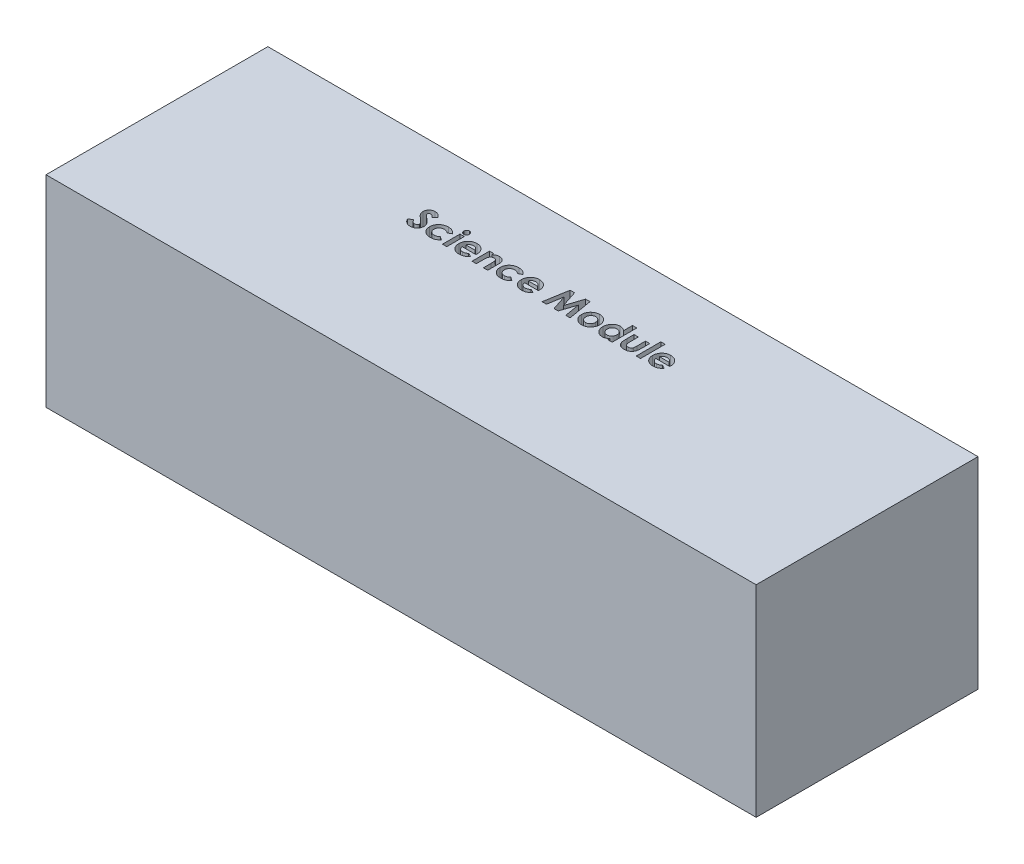
from build123d import *

# Parameters (mm, degrees)
SKETCH1_W           = 564
SKETCH1_H           = 176.20137931
BOSS_EXTRUDE1_DEPTH = 160
SKETCH2_W           = 3.419230769
SKETCH2_H           = 13.921153846
SKETCH2_H_2         = 19.538461538
CUT_EXTRUDE1_DEPTH  = 160


with BuildPart() as part:
    # Sketch1 → Boss-Extrude1 (new body)
    with BuildSketch(Plane(origin=(0, 0, 0), x_dir=(1, 0, 0), z_dir=(0, 1, 0))):
        with Locations((282, 88.100689655)):
            Rectangle(SKETCH1_W, SKETCH1_H)
    extrude(amount=BOSS_EXTRUDE1_DEPTH)

    # Sketch2 → Cut-Extrude1 (cut)
    # profile 1 of 14: a face of its own
    with BuildSketch(Plane(origin=(0, 160, 0), x_dir=(1, 0, 0), z_dir=(0, 1, 0))):
        with BuildLine():
            Line((185.175034233, 126.18146838), (182.618243367, 123.842195543))
            add(Edge.make_bspline(
                [(182.618243367, 123.842195543), (182.50872141, 123.99668765), (182.298454525, 124.293290951), (181.957633836, 124.690449761), (181.618352127, 125.029255783), (181.27746616, 125.30829364), (180.931954451, 125.525867971), (180.582416757, 125.679913001), (180.230834706, 125.777840888), (179.99462584, 125.790035267), (179.878279425, 125.796041697)],
                knots=[0, 0, 0, 0, 1.299362458, 2.494594718, 3.587462134, 4.587049575, 5.512617175, 6.380583204, 7.202344345, 8, 8, 8, 8], degree=3))
            add(Edge.make_bspline(
                [(179.878279425, 125.796041697), (179.769754827, 125.792235747), (179.56022234, 125.784887458), (179.261518235, 125.711846008), (178.996324477, 125.585787192), (178.764899883, 125.420954686), (178.581577461, 125.22236973), (178.435208723, 125.014105171), (178.352790824, 124.784228199), (178.341943007, 124.626339422), (178.336572694, 124.548175111)],
                knots=[0, 0, 0, 0, 1.185010067, 2.2879431, 3.333075148, 4.379039566, 5.372662701, 6.27520591, 7.14612461, 8, 8, 8, 8], degree=3))
            add(Edge.make_bspline(
                [(178.336572694, 124.548175111), (178.339937997, 124.468883636), (178.346715249, 124.309201624), (178.412174282, 124.075167749), (178.510839734, 123.846489409), (178.605118602, 123.707282023), (178.653309473, 123.636125832)],
                knots=[0, 0, 0, 0, 0.967525499, 1.948461899, 2.951351359, 4, 4, 4, 4], degree=3))
            add(Edge.make_bspline(
                [(178.653309473, 123.636125832), (178.697120187, 123.580816869), (178.797966666, 123.453502941), (178.990260246, 123.251857526), (179.231740597, 123.004824242), (179.531700393, 122.720897839), (179.877687476, 122.389867215), (180.285738795, 122.024745308), (180.744108854, 121.614224718), (181.069907672, 121.328353046), (181.240629185, 121.178553716)],
                knots=[0, 0, 0, 0, 0.473873513, 1.090794244, 1.870441696, 2.795289791, 3.865433203, 5.087734844, 6.473946851, 8, 8, 8, 8], degree=3))
            add(Edge.make_bspline(
                [(181.240629185, 121.178553716), (181.400875882, 121.039868283), (181.704990822, 120.776672142), (182.137685989, 120.403107479), (182.517952976, 120.067020461), (182.851331406, 119.773455034), (183.132767586, 119.519331025), (183.363444676, 119.303433724), (183.546180004, 119.129966255), (183.650054338, 119.025191798), (183.694385194, 118.980476793)],
                knots=[0, 0, 0, 0, 1.543621617, 2.929473131, 4.163658386, 5.240097082, 6.164993805, 6.925417477, 7.541396219, 8, 8, 8, 8], degree=3))
            add(Edge.make_bspline(
                [(183.694385194, 118.980476793), (183.862567218, 118.798467824), (184.185872131, 118.448582666), (184.606054546, 117.906370708), (184.951878265, 117.377061278), (185.219414052, 116.85069456), (185.421467838, 116.31967613), (185.563918434, 115.77098279), (185.649233044, 115.198881038), (185.658704958, 114.808491433), (185.663495771, 114.611035688)],
                knots=[0, 0, 0, 0, 1.206664779, 2.319633467, 3.337109185, 4.282041471, 5.190008762, 6.099243693, 7.03861361, 8, 8, 8, 8], degree=3))
            add(Edge.make_bspline(
                [(185.663495771, 114.611035688), (185.660085793, 114.418639279), (185.653395288, 114.041150366), (185.57144944, 113.488751571), (185.45459947, 112.960081949), (185.273928918, 112.460894174), (185.053728718, 111.98299423), (184.777675965, 111.53382628), (184.453489859, 111.108844559), (184.081922804, 110.715646136), (183.670925521, 110.358845821), (183.230091874, 110.041213752), (182.75511117, 109.778968021), (182.25004157, 109.563027367), (181.715153425, 109.396706988), (181.151083949, 109.273780727), (180.556970359, 109.200002323), (180.150706925, 109.192289666), (179.943153223, 109.188349389)],
                knots=[0, 0, 0, 0, 1.043214005, 2.046824704, 3.02475056, 3.976699089, 4.921714032, 5.875962561, 6.831408892, 7.817874052, 8.806269674, 9.781291748, 10.760897367, 11.74438705, 12.757449933, 13.795994037, 14.874007457, 16, 16, 16, 16], degree=3))
            add(Edge.make_bspline(
                [(179.943153223, 109.188349389), (179.780225334, 109.191239839), (179.457534675, 109.196964586), (178.981937429, 109.243702382), (178.522694525, 109.319132213), (178.080323258, 109.427245693), (177.652830669, 109.564240136), (177.2401992, 109.731573599), (176.845277383, 109.93183969), (176.465077054, 110.16092014), (176.101446454, 110.426912719), (175.749787619, 110.724379294), (175.413593556, 111.057895034), (175.091249595, 111.426671189), (174.784818181, 111.831752043), (174.484268716, 112.267496096), (174.202958522, 112.741990165), (174.029180701, 113.074851594), (173.940418848, 113.244869822)],
                knots=[0, 0, 0, 0, 1.016823716, 2.013894106, 2.979844003, 3.91962641, 4.853723003, 5.779685073, 6.695824784, 7.614987388, 8.547259901, 9.504950863, 10.487499108, 11.500346958, 12.559593716, 13.656357062, 14.802919212, 16, 16, 16, 16], degree=3))
            Line((173.940418848, 113.244869822), (176.947510194, 115.049887851))
            add(Edge.make_bspline(
                [(176.947510194, 115.049887851), (177.058538006, 114.856894947), (177.271387811, 114.486911057), (177.632081705, 113.989790807), (178.001594184, 113.564089602), (178.388468048, 113.217331737), (178.787999054, 112.944880614), (179.20211703, 112.750168141), (179.631112927, 112.62964134), (179.923325444, 112.614922234), (180.069084713, 112.607580159)],
                knots=[0, 0, 0, 0, 1.283663364, 2.460892379, 3.537111102, 4.529833553, 5.449777664, 6.316464042, 7.160231139, 8, 8, 8, 8], degree=3))
            add(Edge.make_bspline(
                [(180.069084713, 112.607580159), (180.217342759, 112.613576095), (180.504984959, 112.625209085), (180.915557392, 112.732659506), (181.291985744, 112.901364549), (181.617367632, 113.142083382), (181.892880499, 113.419909502), (182.09622481, 113.729003763), (182.223967077, 114.063436293), (182.237472532, 114.295755126), (182.244265002, 114.412598188)],
                knots=[0, 0, 0, 0, 1.13588714, 2.203786484, 3.234766741, 4.283437687, 5.291419208, 6.222934724, 7.106237994, 8, 8, 8, 8], degree=3))
            add(Edge.make_bspline(
                [(182.244265002, 114.412598188), (182.237992434, 114.521301642), (182.225250313, 114.742122303), (182.131395775, 115.070447118), (181.984672506, 115.398622618), (181.811088532, 115.667801041), (181.634445102, 115.893176839), (181.465534142, 116.088454772), (181.259845275, 116.304202701), (181.017900036, 116.540692021), (180.742895155, 116.800004607), (180.434598975, 117.082115066), (180.089481179, 117.384538343), (179.84555124, 117.590546091), (179.718002983, 117.698265255)],
                knots=[0, 0, 0, 0, 0.916159276, 1.861089862, 2.860218735, 3.940849679, 4.552606315, 5.27541173, 6.11797699, 7.06649574, 8.129236253, 9.306560635, 10.591630461, 12, 12, 12, 12], degree=3))
            add(Edge.make_bspline(
                [(179.718002983, 117.698265255), (179.475528669, 117.903421775), (179.010147071, 118.297179234), (178.352503829, 118.878746605), (177.759908383, 119.422274601), (177.237479024, 119.934482418), (176.778559194, 120.405910763), (176.386256897, 120.840388758), (176.064881753, 121.241267807), (175.726703711, 121.716082213), (175.405366957, 122.294676193), (175.127640814, 122.990791825), (174.947463814, 123.68681913), (174.927277487, 124.154093526), (174.917341925, 124.384082563)],
                knots=[0, 0, 0, 0, 1.345494975, 2.582412109, 3.71882943, 4.751509156, 5.681369928, 6.505683931, 7.230279997, 7.856715994, 8.973648664, 10.023341002, 11.027102913, 12, 12, 12, 12], degree=3))
            add(Edge.make_bspline(
                [(174.917341925, 124.384082563), (174.921474112, 124.547178443), (174.929614965, 124.868494847), (175.002232625, 125.340943802), (175.110762484, 125.796817346), (175.268378999, 126.234452246), (175.472946203, 126.653300347), (175.721385126, 127.055412085), (176.017553554, 127.437086515), (176.351315379, 127.798070614), (176.719035457, 128.127969002), (177.111991091, 128.419137384), (177.527958117, 128.665062434), (177.964391859, 128.86907512), (178.423996717, 129.025233871), (178.903386801, 129.135926977), (179.40324971, 129.201763707), (179.743245671, 129.210713446), (179.916440483, 129.215272466)],
                knots=[0, 0, 0, 0, 1.010766082, 1.991317756, 2.957454644, 3.913069143, 4.869106762, 5.843196583, 6.838735724, 7.860187025, 8.887984031, 9.89767229, 10.887916223, 11.879572884, 12.879850636, 13.892031539, 14.926195476, 16, 16, 16, 16], degree=3))
            add(Edge.make_bspline(
                [(179.916440483, 129.215272466), (180.140892387, 129.207061538), (180.58802445, 129.190704494), (181.249122101, 129.062797759), (181.894854647, 128.861650945), (182.415198034, 128.618989444), (182.829225554, 128.383923132), (183.146538973, 128.167503684), (183.469422457, 127.919583574), (183.80047986, 127.639381541), (184.133559624, 127.32161821), (184.478132798, 126.973858188), (184.829504153, 126.593096014), (185.057839823, 126.321081283), (185.175034233, 126.18146838)],
                knots=[0, 0, 0, 0, 1.282922637, 2.555718331, 3.837320111, 5.142675274, 5.830281639, 6.55870424, 7.337177975, 8.157850921, 9.037902056, 9.96903443, 10.957596896, 12, 12, 12, 12], degree=3))
        make_face()
    # profile 2 of 14: a face of its own
    with BuildSketch(Plane(origin=(0, 160, 0), x_dir=(1, 0, 0), z_dir=(0, 1, 0))):
        with BuildLine():
            Line((202.02695731, 120.758782082), (199.195406829, 119.201810928))
            add(Edge.make_bspline(
                [(199.195406829, 119.201810928), (199.065618875, 119.331782129), (198.816133797, 119.581619453), (198.416064425, 119.897873869), (198.023143767, 120.159723727), (197.62117333, 120.352955472), (197.206559976, 120.498477497), (196.764349106, 120.594859932), (196.289379341, 120.65832434), (195.960842213, 120.664177508), (195.791440483, 120.667195543)],
                knots=[0, 0, 0, 0, 1.150764855, 2.212059359, 3.192108068, 4.105322427, 5.000809612, 5.941206042, 6.938435785, 8, 8, 8, 8], degree=3))
            add(Edge.make_bspline(
                [(195.791440483, 120.667195543), (195.636087405, 120.663443193), (195.332074459, 120.656100159), (194.887863302, 120.601252725), (194.465686118, 120.515108323), (194.066300735, 120.389078759), (193.690418502, 120.222586847), (193.334931032, 120.025568713), (193.00329273, 119.790329093), (192.700191392, 119.520211862), (192.426589161, 119.222818775), (192.182522011, 118.905636269), (191.982573378, 118.563959014), (191.809705384, 118.205817666), (191.682610726, 117.824485528), (191.589625183, 117.423422792), (191.536624289, 117.002611691), (191.528945395, 116.715125817), (191.525034233, 116.568697947)],
                knots=[0, 0, 0, 0, 1.121765476, 2.195200973, 3.227634963, 4.230038321, 5.213228299, 6.192116585, 7.160777141, 8.14345191, 9.118668839, 10.075979138, 11.027630062, 11.972829041, 12.943187208, 13.923755399, 14.94248691, 16, 16, 16, 16], degree=3))
            add(Edge.make_bspline(
                [(191.525034233, 116.568697947), (191.529166713, 116.426091362), (191.537235673, 116.147641902), (191.586808647, 115.73853329), (191.672869195, 115.349079349), (191.801905722, 114.981339009), (191.956570426, 114.631922223), (192.15080098, 114.303607975), (192.37920541, 113.994962599), (192.642986174, 113.708668672), (192.935188323, 113.451182411), (193.250205151, 113.223795384), (193.587096778, 113.031013254), (193.949787653, 112.879722608), (194.33236447, 112.756452382), (194.737382086, 112.668679155), (195.1644095, 112.619958943), (195.455503277, 112.611770205), (195.6044513, 112.607580159)],
                knots=[0, 0, 0, 0, 1.070556293, 2.090336998, 3.088792742, 4.058148387, 5.011235098, 5.952916408, 6.915475435, 7.888633318, 8.869583867, 9.83422472, 10.800707077, 11.776204622, 12.778807041, 13.814557445, 14.881744048, 16, 16, 16, 16], degree=3))
            add(Edge.make_bspline(
                [(195.6044513, 112.607580159), (195.787842016, 112.611776675), (196.145794044, 112.619967664), (196.666152412, 112.689441001), (197.155802516, 112.80432547), (197.614796283, 112.963334699), (198.04249157, 113.171242229), (198.437789448, 113.425185768), (198.804753567, 113.723292009), (199.018746824, 113.95570235), (199.126716925, 114.072964774)],
                knots=[0, 0, 0, 0, 1.116373375, 2.178998604, 3.189797796, 4.174590301, 5.13072713, 6.078291395, 7.030403691, 8, 8, 8, 8], degree=3))
            Line((199.126716925, 114.072964774), (201.78272654, 112.248866216))
            add(Edge.make_bspline(
                [(201.78272654, 112.248866216), (201.59862471, 112.023778449), (201.23531375, 111.579584858), (200.60143687, 111.007035533), (199.919193888, 110.515088443), (199.174863427, 110.12242251), (198.379285396, 109.810106957), (197.526243119, 109.589330868), (196.617179457, 109.459369391), (195.992850528, 109.441652638), (195.673141204, 109.432580159)],
                knots=[0, 0, 0, 0, 0.997876357, 1.969233105, 2.924898516, 3.881013542, 4.852507933, 5.855329832, 6.901747111, 8, 8, 8, 8], degree=3))
            add(Edge.make_bspline(
                [(195.673141204, 109.432580159), (195.385382984, 109.439232275), (194.823359452, 109.452224592), (194.004224117, 109.551721222), (193.2337848, 109.719309753), (192.510456589, 109.952055777), (191.834898949, 110.253549032), (191.209302773, 110.627513318), (190.629448428, 111.063546313), (190.105798813, 111.563707817), (189.638583204, 112.108139016), (189.230702293, 112.681511629), (188.877948224, 113.27355249), (188.601213002, 113.894115892), (188.375044054, 114.533529299), (188.222296646, 115.199435989), (188.121550323, 115.886350802), (188.111094664, 116.352087387), (188.105803463, 116.587778476)],
                knots=[0, 0, 0, 0, 1.183377041, 2.311265848, 3.387807024, 4.421911742, 5.431260577, 6.423665966, 7.413571885, 8.409103097, 9.395976332, 10.359992013, 11.300391101, 12.225292883, 13.150239058, 14.085544813, 15.031169026, 16, 16, 16, 16], degree=3))
            add(Edge.make_bspline(
                [(188.105803463, 116.587778476), (188.108637998, 116.751986457), (188.114252339, 117.077231977), (188.162181058, 117.560257846), (188.236742041, 118.035086958), (188.348798394, 118.498386263), (188.486607929, 118.95240352), (188.654134077, 119.397047465), (188.857984691, 119.830023661), (189.085380669, 120.25501526), (189.344548754, 120.660803114), (189.627295761, 121.047208127), (189.933223321, 121.411863745), (190.265925311, 121.75137148), (190.623081922, 122.068160644), (190.99950102, 122.368658301), (191.407363348, 122.637367099), (191.832490033, 122.890003001), (192.278543106, 123.114897613), (192.740395793, 123.309011313), (193.214479006, 123.473938897), (193.7019291, 123.606544002), (194.200653838, 123.71583492), (194.715090991, 123.785195429), (195.240984457, 123.833947442), (195.596703316, 123.8394296), (195.77617606, 123.842195543)],
                knots=[0, 0, 0, 0, 1.00272354, 1.986087015, 2.96193297, 3.936200312, 4.894695956, 5.858592327, 6.835334787, 7.815655071, 8.800643866, 9.773423113, 10.738352213, 11.705312252, 12.673769326, 13.65298065, 14.64420052, 15.654211674, 16.672258995, 17.692438602, 18.712115155, 19.735602823, 20.776372304, 21.827874031, 22.90408564, 24, 24, 24, 24], degree=3))
            add(Edge.make_bspline(
                [(195.77617606, 123.842195543), (195.942883212, 123.840310777), (196.271664968, 123.83659362), (196.7572013, 123.797725572), (197.229493188, 123.731706485), (197.689344385, 123.644366014), (198.138151451, 123.53613596), (198.569899183, 123.391868924), (198.990490298, 123.22813127), (199.532216099, 122.98090451), (200.170811666, 122.611878555), (200.87181851, 122.082613986), (201.496850972, 121.463451634), (201.849316006, 120.994920398), (202.02695731, 120.758782082)],
                knots=[0, 0, 0, 0, 0.826738014, 1.630502179, 2.413926014, 3.191023582, 3.95155221, 4.701751672, 5.446919844, 6.189438973, 7.653650558, 9.094719814, 10.535747635, 12, 12, 12, 12], degree=3))
        make_face()
    # profile 3 of 14: a face of its own
    with BuildSketch(Plane(origin=(0, 160, 0), x_dir=(1, 0, 0), z_dir=(0, 1, 0))):
        with BuildLine():
            add(Edge.make_bspline(
                [(206.903940483, 129.459503236), (207.051309305, 129.452272763), (207.340682185, 129.438075035), (207.755248214, 129.299678762), (208.135735811, 129.082469948), (208.472097398, 128.784454278), (208.751851514, 128.428569059), (208.965594048, 128.030131895), (209.08466111, 127.588676351), (209.101197763, 127.283723478), (209.109649617, 127.127862611)],
                knots=[0, 0, 0, 0, 0.989868614, 1.943702388, 2.910836514, 3.924849579, 4.949916355, 5.946401046, 6.950409252, 8, 8, 8, 8], degree=3))
            add(Edge.make_bspline(
                [(209.109649617, 127.127862611), (209.101500156, 126.973150352), (209.085620543, 126.671686149), (208.962853646, 126.236223569), (208.757689995, 125.837979927), (208.475670046, 125.487380264), (208.142955058, 125.194164312), (207.770781407, 124.973012203), (207.360188122, 124.842314884), (207.075305435, 124.826930304), (206.930653223, 124.81911862)],
                knots=[0, 0, 0, 0, 1.05296456, 2.051751585, 3.055639087, 4.085634717, 5.099016424, 6.062201612, 7.016062274, 8, 8, 8, 8], degree=3))
            add(Edge.make_bspline(
                [(206.930653223, 124.81911862), (206.781997993, 124.826323245), (206.49010758, 124.84046981), (206.072141256, 124.979189898), (205.686578927, 125.194688051), (205.351676474, 125.498792644), (205.06871855, 125.857206696), (204.864312374, 126.264919822), (204.736451254, 126.709394029), (204.721274252, 127.018863461), (204.713495771, 127.177471986)],
                knots=[0, 0, 0, 0, 0.989065327, 1.942068821, 2.907541208, 3.917690034, 4.939857478, 5.938239964, 6.943311734, 8, 8, 8, 8], degree=3))
            add(Edge.make_bspline(
                [(204.713495771, 127.177471986), (204.721960884, 127.329557138), (204.738589378, 127.628306464), (204.858369665, 128.059947158), (205.067211089, 128.451685969), (205.344950109, 128.801056376), (205.678357309, 129.093512933), (206.058616493, 129.304124973), (206.470392479, 129.436805086), (206.757932285, 129.451859063), (206.903940483, 129.459503236)],
                knots=[0, 0, 0, 0, 1.038616768, 2.040212704, 3.031499824, 4.052181184, 5.074969369, 6.039807101, 7.004644834, 8, 8, 8, 8], degree=3))
        make_face()
    # profile 4 of 14: a face of its own
    with BuildSketch(Plane(origin=(0, 160, 0), x_dir=(1, 0, 0), z_dir=(0, 1, 0))):
        with Locations((206.911572695, 116.637387851)):
            Rectangle(SKETCH2_W, SKETCH2_H)
    # profile 5 of 14: a face of its own
    with BuildSketch(Plane(origin=(0, 160, 0), x_dir=(1, 0, 0), z_dir=(0, 1, 0))):
        with BuildLine():
            Line((225.705893608, 115.782580159), (214.72695731, 115.782580159))
            add(Edge.make_bspline(
                [(214.72695731, 115.782580159), (214.749342474, 115.655011148), (214.793331089, 115.404327976), (214.888853929, 115.040188916), (215.010755399, 114.697030413), (215.156846635, 114.374393747), (215.324664538, 114.070573265), (215.520410219, 113.786994003), (215.741600822, 113.523906439), (215.986957482, 113.282453976), (216.252390549, 113.066107337), (216.53661277, 112.876574005), (216.839917445, 112.721168267), (217.158827301, 112.590177356), (217.495725327, 112.486419284), (217.851107353, 112.414859315), (218.224031314, 112.372588579), (218.47807851, 112.366474601), (218.607936877, 112.363349389)],
                knots=[0, 0, 0, 0, 1.091296461, 2.144483647, 3.168565212, 4.157007626, 5.126487748, 6.090021542, 7.05641414, 8.019231907, 8.98705074, 9.938580405, 10.892824166, 11.854447369, 12.841318655, 13.858982407, 14.905600794, 16, 16, 16, 16], degree=3))
            add(Edge.make_bspline(
                [(218.607936877, 112.363349389), (218.764684741, 112.367487685), (219.073367448, 112.375637206), (219.525589912, 112.447911359), (219.962954908, 112.557078291), (220.381323424, 112.719418681), (220.7855416, 112.921503929), (221.168954766, 113.173277283), (221.538199501, 113.467381102), (221.763482304, 113.694076213), (221.878339521, 113.809653476)],
                knots=[0, 0, 0, 0, 1.021034703, 2.010718019, 2.977989445, 3.954245119, 4.929443971, 5.918328161, 6.938689359, 8, 8, 8, 8], degree=3))
            Line((221.878339521, 113.809653476), (224.740418848, 112.447303716))
            add(Edge.make_bspline(
                [(224.740418848, 112.447303716), (224.650307951, 112.322784286), (224.471756522, 112.076053615), (224.180277306, 111.728839838), (223.876100184, 111.404875297), (223.558998301, 111.106290758), (223.228569493, 110.833937069), (222.885732932, 110.584496469), (222.525478203, 110.364666338), (222.155008533, 110.163811427), (221.766665629, 109.991619444), (221.361524208, 109.844780199), (220.941300271, 109.712038771), (220.500687297, 109.610897074), (220.043354266, 109.530834132), (219.568207149, 109.473978837), (219.075308567, 109.438862045), (218.740288273, 109.434698992), (218.569775819, 109.432580159)],
                knots=[0, 0, 0, 0, 1.028154879, 2.037251081, 3.030720504, 4.000128189, 4.949298328, 5.894184978, 6.834267904, 7.770992897, 8.712077017, 9.673380525, 10.653304757, 11.658697181, 12.695551717, 13.758623199, 14.859225354, 16, 16, 16, 16], degree=3))
            add(Edge.make_bspline(
                [(218.569775819, 109.432580159), (218.307445209, 109.437928291), (217.793685829, 109.448402299), (217.042219862, 109.545616084), (216.328535621, 109.706807018), (215.650617909, 109.925921337), (215.011397139, 110.215220881), (214.410556959, 110.569058222), (213.842094116, 110.98064959), (213.323378323, 111.458633192), (212.850812932, 111.978889925), (212.435740875, 112.537610132), (212.088414488, 113.130890242), (211.803183074, 113.754803806), (211.58149131, 114.410947796), (211.421664408, 115.099608541), (211.323688602, 115.820457125), (211.313106728, 116.311435478), (211.30772654, 116.561065736)],
                knots=[0, 0, 0, 0, 1.103565453, 2.161269334, 3.182010356, 4.179077853, 5.15417608, 6.128274628, 7.109042802, 8.101804412, 9.090965879, 10.063106201, 11.02526161, 11.978650795, 12.945248442, 13.93468508, 14.949922959, 16, 16, 16, 16], degree=3))
            add(Edge.make_bspline(
                [(211.30772654, 116.561065736), (211.313159681, 116.817039418), (211.32384914, 117.320656144), (211.420820837, 118.058149451), (211.581933177, 118.761817816), (211.804273438, 119.432630265), (212.085177856, 120.072684811), (212.436923376, 120.676381745), (212.850606954, 121.24582281), (213.321469938, 121.778344104), (213.842383171, 122.259002751), (214.395902695, 122.687365661), (214.988247871, 123.04430607), (215.612718763, 123.332713701), (216.26532103, 123.56703762), (216.953597844, 123.722960618), (217.672312466, 123.827653578), (218.163609955, 123.837295146), (218.413315483, 123.842195543)],
                knots=[0, 0, 0, 0, 1.079208495, 2.12329425, 3.130605359, 4.119693003, 5.099659317, 6.073216462, 7.060498243, 8.06384408, 9.066070512, 10.045757761, 11.010926815, 11.975797609, 12.942977511, 13.929384301, 14.947594487, 16, 16, 16, 16], degree=3))
            add(Edge.make_bspline(
                [(218.413315483, 123.842195543), (218.676902834, 123.836764439), (219.194429434, 123.826101026), (219.95112913, 123.729676594), (220.669552149, 123.567502737), (221.352759375, 123.350283059), (221.992025973, 123.053675504), (222.601398567, 122.708545539), (223.166260948, 122.288057312), (223.692633946, 121.812412809), (224.167793153, 121.284701715), (224.583134949, 120.711445841), (224.936539697, 120.098239828), (225.222977754, 119.442596994), (225.444441881, 118.746485643), (225.604416732, 118.010809813), (225.701645216, 117.232771346), (225.712030185, 116.700003816), (225.717341925, 116.427502034)],
                knots=[0, 0, 0, 0, 1.080001299, 2.120471247, 3.119684163, 4.095710327, 5.052285597, 6.002875087, 6.961153713, 7.931888285, 8.906493152, 9.865905668, 10.82813294, 11.801621613, 12.7925306, 13.817193356, 14.883530496, 16, 16, 16, 16], degree=3))
            Line((225.717341925, 116.427502034), (225.705893608, 115.782580159))
        make_face()
        with BuildLine():
            add(Edge.make_bspline(
                [(222.298111156, 118.46911862), (222.23358818, 118.643239995), (222.105299695, 118.989438647), (221.815501349, 119.467108313), (221.430948215, 119.880789644), (220.983685332, 120.247025007), (220.472659483, 120.544284504), (219.913973986, 120.759510034), (219.31469052, 120.888561962), (218.902415788, 120.903697486), (218.691891204, 120.911426313)],
                knots=[0, 0, 0, 0, 0.954238005, 1.897273737, 2.851915805, 3.847685534, 4.862635127, 5.880135777, 6.917509367, 8, 8, 8, 8], degree=3))
            add(Edge.make_bspline(
                [(218.691891204, 120.911426313), (218.461964081, 120.904001834), (218.012504431, 120.889488523), (217.364189488, 120.73513414), (216.752650224, 120.504764834), (216.392121334, 120.267249187), (216.211422454, 120.148205159)],
                knots=[0, 0, 0, 0, 1.044195649, 2.041185066, 3.018232172, 4, 4, 4, 4], degree=3))
            add(Edge.make_bspline(
                [(216.211422454, 120.148205159), (216.098679848, 120.057538619), (215.858318376, 119.864242192), (215.546160241, 119.478634171), (215.23868188, 119.011749421), (215.063863479, 118.657117469), (214.971188079, 118.46911862)],
                knots=[0, 0, 0, 0, 0.82159062, 1.751589201, 2.808063854, 4, 4, 4, 4], degree=3))
            Line((214.971188079, 118.46911862), (222.298111156, 118.46911862))
        make_face(mode=Mode.SUBTRACT)
    # profile 6 of 14: a face of its own
    with BuildSketch(Plane(origin=(0, 160, 0), x_dir=(1, 0, 0), z_dir=(0, 1, 0))):
        with BuildLine():
            Line((228.648111156, 123.597964774), (232.067341925, 123.597964774))
            Line((232.067341925, 123.597964774), (232.067341925, 122.124947947))
            add(Edge.make_bspline(
                [(232.067341925, 122.124947947), (232.262407345, 122.276673849), (232.635215284, 122.566651541), (233.201947718, 122.936374577), (233.736872968, 123.238978035), (234.251915092, 123.469153711), (234.756764621, 123.634755213), (235.259597955, 123.753730011), (235.767903301, 123.829912846), (236.109607877, 123.838103508), (236.280322694, 123.842195543)],
                knots=[0, 0, 0, 0, 1.276643801, 2.439914479, 3.493451431, 4.44993799, 5.350072675, 6.235028322, 7.118224225, 8, 8, 8, 8], degree=3))
            add(Edge.make_bspline(
                [(236.280322694, 123.842195543), (236.453489903, 123.837519194), (236.793431678, 123.828339127), (237.29397721, 123.764131997), (237.772199854, 123.647190475), (238.233476831, 123.491923762), (238.673113131, 123.286980606), (239.096494567, 123.043643859), (239.494527053, 122.747243238), (239.73965308, 122.521518756), (239.863646011, 122.407339774)],
                knots=[0, 0, 0, 0, 1.048836932, 2.058954983, 3.049370783, 4.026390553, 5.001981509, 5.982488534, 6.97947532, 8, 8, 8, 8], degree=3))
            add(Edge.make_bspline(
                [(239.863646011, 122.407339774), (239.963092907, 122.301529246), (240.162714529, 122.089133783), (240.413913261, 121.725670746), (240.629470027, 121.32942951), (240.806088846, 120.8958393), (240.936603037, 120.422517823), (241.037009386, 119.915182124), (241.093349139, 119.370991497), (241.100304547, 118.997137672), (241.103880386, 118.804935928)],
                knots=[0, 0, 0, 0, 0.889584746, 1.785680191, 2.700364693, 3.65222533, 4.649950538, 5.707241244, 6.821271309, 8, 8, 8, 8], degree=3))
            Line((241.103880386, 118.804935928), (241.103880386, 109.676810928))
            Line((241.103880386, 109.676810928), (237.684649617, 109.676810928))
            Line((237.684649617, 109.676810928), (237.684649617, 115.721522466))
            add(Edge.make_bspline(
                [(237.684649617, 115.721522466), (237.683926525, 115.918690426), (237.682540854, 116.296526226), (237.671901965, 116.837266038), (237.651128656, 117.325624311), (237.632194326, 117.762490203), (237.595018709, 118.146312547), (237.561493137, 118.479521233), (237.510051397, 118.759093365), (237.443117347, 119.059815141), (237.326234012, 119.381792794), (237.144778332, 119.721049445), (236.914576356, 120.009255533), (236.645030454, 120.248431526), (236.336438313, 120.437641675), (235.992528826, 120.5707628), (235.615145753, 120.653727154), (235.352189663, 120.662591855), (235.215629185, 120.667195543)],
                knots=[0, 0, 0, 0, 1.49886392, 2.872294502, 4.110984203, 5.214877267, 6.195405875, 7.042225351, 7.75923308, 8.355011229, 9.382752534, 10.352059385, 11.267231453, 12.171456522, 13.078624015, 14.003401117, 14.963110155, 16, 16, 16, 16], degree=3))
            add(Edge.make_bspline(
                [(235.215629185, 120.667195543), (235.038026538, 120.658189266), (234.690601235, 120.640571236), (234.188120037, 120.507715215), (233.72659943, 120.281766233), (233.309810414, 119.969098275), (232.941722559, 119.583070937), (232.638555635, 119.122689054), (232.389896478, 118.599063915), (232.282969344, 118.216732512), (232.227618367, 118.018818139)],
                knots=[0, 0, 0, 0, 0.984188326, 1.925263693, 2.85911992, 3.81709677, 4.80007086, 5.801799564, 6.862098548, 8, 8, 8, 8], degree=3))
            add(Edge.make_bspline(
                [(232.227618367, 118.018818139), (232.213861451, 117.956661805), (232.18318076, 117.818040681), (232.157949774, 117.583855445), (232.122851641, 117.306017337), (232.109701233, 116.979498267), (232.08683412, 116.605843516), (232.07837677, 116.184558748), (232.069904286, 115.71647003), (232.068224341, 115.389527846), (232.067341925, 115.217796505)],
                knots=[0, 0, 0, 0, 0.543362196, 1.211806945, 2.009705693, 2.934833164, 4.000995085, 5.207458376, 6.533175157, 8, 8, 8, 8], degree=3))
            Line((232.067341925, 115.217796505), (232.067341925, 109.676810928))
            Line((232.067341925, 109.676810928), (228.648111156, 109.676810928))
            Line((228.648111156, 109.676810928), (228.648111156, 123.597964774))
        make_face()
    # profile 7 of 14: a face of its own
    with BuildSketch(Plane(origin=(0, 160, 0), x_dir=(1, 0, 0), z_dir=(0, 1, 0))):
        with BuildLine():
            Line((257.955803463, 120.758782082), (255.124252983, 119.201810928))
            add(Edge.make_bspline(
                [(255.124252983, 119.201810928), (254.994465028, 119.331782129), (254.744979951, 119.581619453), (254.344910579, 119.897873869), (253.95198992, 120.159723727), (253.550019484, 120.352955472), (253.13540613, 120.498477497), (252.69319526, 120.594859932), (252.218225495, 120.65832434), (251.889688367, 120.664177508), (251.720286636, 120.667195543)],
                knots=[0, 0, 0, 0, 1.150764855, 2.212059359, 3.192108068, 4.105322427, 5.000809612, 5.941206042, 6.938435785, 8, 8, 8, 8], degree=3))
            add(Edge.make_bspline(
                [(251.720286636, 120.667195543), (251.564933559, 120.663443193), (251.260920613, 120.656100159), (250.816709456, 120.601252725), (250.394532272, 120.515108323), (249.995146889, 120.389078759), (249.619264656, 120.222586847), (249.263777186, 120.025568713), (248.932138884, 119.790329093), (248.629037546, 119.520211862), (248.355435315, 119.222818775), (248.111368165, 118.905636269), (247.911419532, 118.563959014), (247.738551538, 118.205817666), (247.61145688, 117.824485528), (247.518471337, 117.423422792), (247.465470443, 117.002611691), (247.457791549, 116.715125817), (247.453880386, 116.568697947)],
                knots=[0, 0, 0, 0, 1.121765476, 2.195200973, 3.227634963, 4.230038321, 5.213228299, 6.192116585, 7.160777141, 8.14345191, 9.118668839, 10.075979138, 11.027630062, 11.972829041, 12.943187208, 13.923755399, 14.94248691, 16, 16, 16, 16], degree=3))
            add(Edge.make_bspline(
                [(247.453880386, 116.568697947), (247.458012867, 116.426091362), (247.466081827, 116.147641902), (247.515654801, 115.73853329), (247.601715349, 115.349079349), (247.730751876, 114.981339009), (247.885416579, 114.631922223), (248.079647133, 114.303607975), (248.308051564, 113.994962599), (248.571832328, 113.708668672), (248.864034477, 113.451182411), (249.179051304, 113.223795384), (249.515942931, 113.031013254), (249.878633807, 112.879722608), (250.261210623, 112.756452382), (250.66622824, 112.668679155), (251.093255654, 112.619958943), (251.384349431, 112.611770205), (251.533297454, 112.607580159)],
                knots=[0, 0, 0, 0, 1.070556293, 2.090336998, 3.088792742, 4.058148387, 5.011235098, 5.952916408, 6.915475435, 7.888633318, 8.869583867, 9.83422472, 10.800707077, 11.776204622, 12.778807041, 13.814557445, 14.881744048, 16, 16, 16, 16], degree=3))
            add(Edge.make_bspline(
                [(251.533297454, 112.607580159), (251.71668817, 112.611776675), (252.074640198, 112.619967664), (252.594998566, 112.689441001), (253.084648669, 112.80432547), (253.543642437, 112.963334699), (253.971337724, 113.171242229), (254.366635602, 113.425185768), (254.73359972, 113.723292009), (254.947592978, 113.95570235), (255.055563079, 114.072964774)],
                knots=[0, 0, 0, 0, 1.116373375, 2.178998604, 3.189797796, 4.174590301, 5.13072713, 6.078291395, 7.030403691, 8, 8, 8, 8], degree=3))
            Line((255.055563079, 114.072964774), (257.711572694, 112.248866216))
            add(Edge.make_bspline(
                [(257.711572694, 112.248866216), (257.527470864, 112.023778449), (257.164159904, 111.579584858), (256.530283024, 111.007035533), (255.848040042, 110.515088443), (255.103709581, 110.12242251), (254.30813155, 109.810106957), (253.455089273, 109.589330868), (252.546025611, 109.459369391), (251.921696682, 109.441652638), (251.601987358, 109.432580159)],
                knots=[0, 0, 0, 0, 0.997876357, 1.969233105, 2.924898516, 3.881013542, 4.852507933, 5.855329832, 6.901747111, 8, 8, 8, 8], degree=3))
            add(Edge.make_bspline(
                [(251.601987358, 109.432580159), (251.314229138, 109.439232275), (250.752205606, 109.452224592), (249.933070271, 109.551721222), (249.162630954, 109.719309753), (248.439302743, 109.952055777), (247.763745103, 110.253549032), (247.138148927, 110.627513318), (246.558294582, 111.063546313), (246.034644967, 111.563707817), (245.567429358, 112.108139016), (245.159548447, 112.681511629), (244.806794378, 113.27355249), (244.530059155, 113.894115892), (244.303890208, 114.533529299), (244.1511428, 115.199435989), (244.050396476, 115.886350802), (244.039940818, 116.352087387), (244.034649617, 116.587778476)],
                knots=[0, 0, 0, 0, 1.183377041, 2.311265848, 3.387807024, 4.421911742, 5.431260577, 6.423665966, 7.413571885, 8.409103097, 9.395976332, 10.359992013, 11.300391101, 12.225292883, 13.150239058, 14.085544813, 15.031169026, 16, 16, 16, 16], degree=3))
            add(Edge.make_bspline(
                [(244.034649617, 116.587778476), (244.037484152, 116.751986457), (244.043098493, 117.077231977), (244.091027212, 117.560257846), (244.165588194, 118.035086958), (244.277644548, 118.498386263), (244.415454082, 118.95240352), (244.582980231, 119.397047465), (244.786830845, 119.830023661), (245.014226823, 120.25501526), (245.273394908, 120.660803114), (245.556141915, 121.047208127), (245.862069475, 121.411863745), (246.194771465, 121.75137148), (246.551928076, 122.068160644), (246.928347174, 122.368658301), (247.336209502, 122.637367099), (247.761336187, 122.890003001), (248.20738926, 123.114897613), (248.669241947, 123.309011313), (249.14332516, 123.473938897), (249.630775254, 123.606544002), (250.129499992, 123.71583492), (250.643937145, 123.785195429), (251.169830611, 123.833947442), (251.52554947, 123.8394296), (251.705022213, 123.842195543)],
                knots=[0, 0, 0, 0, 1.00272354, 1.986087015, 2.96193297, 3.936200312, 4.894695956, 5.858592327, 6.835334787, 7.815655071, 8.800643866, 9.773423113, 10.738352213, 11.705312252, 12.673769326, 13.65298065, 14.64420052, 15.654211674, 16.672258995, 17.692438602, 18.712115155, 19.735602823, 20.776372304, 21.827874031, 22.90408564, 24, 24, 24, 24], degree=3))
            add(Edge.make_bspline(
                [(251.705022213, 123.842195543), (251.871729366, 123.840310777), (252.200511122, 123.83659362), (252.686047454, 123.797725572), (253.158339341, 123.731706485), (253.618190538, 123.644366014), (254.066997605, 123.53613596), (254.498745337, 123.391868924), (254.919336452, 123.22813127), (255.461062252, 122.98090451), (256.09965782, 122.611878555), (256.800664664, 122.082613986), (257.425697126, 121.463451634), (257.77816216, 120.994920398), (257.955803463, 120.758782082)],
                knots=[0, 0, 0, 0, 0.826738014, 1.630502179, 2.413926014, 3.191023582, 3.95155221, 4.701751672, 5.446919844, 6.189438973, 7.653650558, 9.094719814, 10.535747635, 12, 12, 12, 12], degree=3))
        make_face()
    # profile 8 of 14: a face of its own
    with BuildSketch(Plane(origin=(0, 160, 0), x_dir=(1, 0, 0), z_dir=(0, 1, 0))):
        with BuildLine():
            Line((275.284739761, 115.782580159), (264.305803463, 115.782580159))
            add(Edge.make_bspline(
                [(264.305803463, 115.782580159), (264.328188628, 115.655011148), (264.372177242, 115.404327976), (264.467700083, 115.040188916), (264.589601553, 114.697030413), (264.735692789, 114.374393747), (264.903510692, 114.070573265), (265.099256373, 113.786994003), (265.320446976, 113.523906439), (265.565803636, 113.282453976), (265.831236702, 113.066107337), (266.115458924, 112.876574005), (266.418763599, 112.721168267), (266.737673455, 112.590177356), (267.074571481, 112.486419284), (267.429953507, 112.414859315), (267.802877468, 112.372588579), (268.056924663, 112.366474601), (268.186783031, 112.363349389)],
                knots=[0, 0, 0, 0, 1.091296461, 2.144483647, 3.168565212, 4.157007626, 5.126487748, 6.090021542, 7.05641414, 8.019231907, 8.98705074, 9.938580405, 10.892824166, 11.854447369, 12.841318655, 13.858982407, 14.905600794, 16, 16, 16, 16], degree=3))
            add(Edge.make_bspline(
                [(268.186783031, 112.363349389), (268.343530895, 112.367487685), (268.652213602, 112.375637206), (269.104436066, 112.447911359), (269.541801062, 112.557078291), (269.960169577, 112.719418681), (270.364387754, 112.921503929), (270.74780092, 113.173277283), (271.117045655, 113.467381102), (271.342328457, 113.694076213), (271.457185675, 113.809653476)],
                knots=[0, 0, 0, 0, 1.021034703, 2.010718019, 2.977989445, 3.954245119, 4.929443971, 5.918328161, 6.938689359, 8, 8, 8, 8], degree=3))
            Line((271.457185675, 113.809653476), (274.319265002, 112.447303716))
            add(Edge.make_bspline(
                [(274.319265002, 112.447303716), (274.229154105, 112.322784286), (274.050602676, 112.076053615), (273.75912346, 111.728839838), (273.454946338, 111.404875297), (273.137844455, 111.106290758), (272.807415647, 110.833937069), (272.464579086, 110.584496469), (272.104324356, 110.364666338), (271.733854687, 110.163811427), (271.345511783, 109.991619444), (270.940370362, 109.844780199), (270.520146425, 109.712038771), (270.079533451, 109.610897074), (269.62220042, 109.530834132), (269.147053302, 109.473978837), (268.654154721, 109.438862045), (268.319134426, 109.434698992), (268.148621973, 109.432580159)],
                knots=[0, 0, 0, 0, 1.028154879, 2.037251081, 3.030720504, 4.000128189, 4.949298328, 5.894184978, 6.834267904, 7.770992897, 8.712077017, 9.673380525, 10.653304757, 11.658697181, 12.695551717, 13.758623199, 14.859225354, 16, 16, 16, 16], degree=3))
            add(Edge.make_bspline(
                [(268.148621973, 109.432580159), (267.886291363, 109.437928291), (267.372531983, 109.448402299), (266.621066016, 109.545616084), (265.907381775, 109.706807018), (265.229464063, 109.925921337), (264.590243293, 110.215220881), (263.989403113, 110.569058222), (263.420940269, 110.98064959), (262.902224477, 111.458633192), (262.429659086, 111.978889925), (262.014587029, 112.537610132), (261.667260642, 113.130890242), (261.382029228, 113.754803806), (261.160337464, 114.410947796), (261.000510562, 115.099608541), (260.902534756, 115.820457125), (260.891952882, 116.311435478), (260.886572694, 116.561065736)],
                knots=[0, 0, 0, 0, 1.103565453, 2.161269334, 3.182010356, 4.179077853, 5.15417608, 6.128274628, 7.109042802, 8.101804412, 9.090965879, 10.063106201, 11.02526161, 11.978650795, 12.945248442, 13.93468508, 14.949922959, 16, 16, 16, 16], degree=3))
            add(Edge.make_bspline(
                [(260.886572694, 116.561065736), (260.892005834, 116.817039418), (260.902695294, 117.320656144), (260.999666991, 118.058149451), (261.160779331, 118.761817816), (261.383119592, 119.432630265), (261.66402401, 120.072684811), (262.015769529, 120.676381745), (262.429453108, 121.24582281), (262.900316092, 121.778344104), (263.421229324, 122.259002751), (263.974748849, 122.687365661), (264.567094024, 123.04430607), (265.191564916, 123.332713701), (265.844167184, 123.56703762), (266.532443998, 123.722960618), (267.25115862, 123.827653578), (267.742456109, 123.837295146), (267.992161636, 123.842195543)],
                knots=[0, 0, 0, 0, 1.079208495, 2.12329425, 3.130605359, 4.119693003, 5.099659317, 6.073216462, 7.060498243, 8.06384408, 9.066070512, 10.045757761, 11.010926815, 11.975797609, 12.942977511, 13.929384301, 14.947594487, 16, 16, 16, 16], degree=3))
            add(Edge.make_bspline(
                [(267.992161636, 123.842195543), (268.255748988, 123.836764439), (268.773275588, 123.826101026), (269.529975284, 123.729676594), (270.248398302, 123.567502737), (270.931605529, 123.350283059), (271.570872126, 123.053675504), (272.180244721, 122.708545539), (272.745107102, 122.288057312), (273.271480099, 121.812412809), (273.746639307, 121.284701715), (274.161981103, 120.711445841), (274.515385851, 120.098239828), (274.801823908, 119.442596994), (275.023288035, 118.746485643), (275.183262886, 118.010809813), (275.28049137, 117.232771346), (275.290876339, 116.700003816), (275.296188079, 116.427502034)],
                knots=[0, 0, 0, 0, 1.080001299, 2.120471247, 3.119684163, 4.095710327, 5.052285597, 6.002875087, 6.961153713, 7.931888285, 8.906493152, 9.865905668, 10.82813294, 11.801621613, 12.7925306, 13.817193356, 14.883530496, 16, 16, 16, 16], degree=3))
            Line((275.296188079, 116.427502034), (275.284739761, 115.782580159))
        make_face()
        with BuildLine():
            add(Edge.make_bspline(
                [(271.87695731, 118.46911862), (271.812434334, 118.643239995), (271.684145849, 118.989438647), (271.394347503, 119.467108313), (271.009794369, 119.880789644), (270.562531486, 120.247025007), (270.051505636, 120.544284504), (269.49282014, 120.759510034), (268.893536674, 120.888561962), (268.481261942, 120.903697486), (268.270737358, 120.911426313)],
                knots=[0, 0, 0, 0, 0.954238005, 1.897273737, 2.851915805, 3.847685534, 4.862635127, 5.880135777, 6.917509367, 8, 8, 8, 8], degree=3))
            add(Edge.make_bspline(
                [(268.270737358, 120.911426313), (268.040810234, 120.904001834), (267.591350585, 120.889488523), (266.943035641, 120.73513414), (266.331496378, 120.504764834), (265.970967488, 120.267249187), (265.790268608, 120.148205159)],
                knots=[0, 0, 0, 0, 1.044195649, 2.041185066, 3.018232172, 4, 4, 4, 4], degree=3))
            add(Edge.make_bspline(
                [(265.790268608, 120.148205159), (265.677526002, 120.057538619), (265.43716453, 119.864242192), (265.125006395, 119.478634171), (264.817528033, 119.011749421), (264.642709633, 118.657117469), (264.550034233, 118.46911862)],
                knots=[0, 0, 0, 0, 0.82159062, 1.751589201, 2.808063854, 4, 4, 4, 4], degree=3))
            Line((264.550034233, 118.46911862), (271.87695731, 118.46911862))
        make_face(mode=Mode.SUBTRACT)
    # profile 9 of 14: a face of its own
    with BuildSketch(Plane(origin=(0, 160, 0), x_dir=(1, 0, 0), z_dir=(0, 1, 0))):
        Polygon((287.549703704, 128.726810928), (291.098682069, 128.726810928), (295.44522654, 115.439130639), (299.822299858, 128.726810928), (303.336933271, 128.726810928), (306.55772654, 109.676810928), (303.096518608, 109.676810928), (301.062534233, 121.708992418), (297.101416444, 109.676810928), (293.766140002, 109.676810928), (289.827918848, 121.708992418), (287.797750579, 109.676810928), (284.33272654, 109.676810928), align=None)
    # profile 10 of 14: a face of its own
    with BuildSketch(Plane(origin=(0, 160, 0), x_dir=(1, 0, 0), z_dir=(0, 1, 0))):
        with BuildLine():
            add(Edge.make_bspline(
                [(315.876656829, 123.842195543), (316.038311459, 123.839318789), (316.358460875, 123.833621511), (316.835283436, 123.786196875), (317.30377004, 123.708821625), (317.766613484, 123.608634184), (318.219515835, 123.468256593), (318.664852511, 123.29989538), (319.106605387, 123.106597018), (319.533810246, 122.876504355), (319.949553323, 122.626947879), (320.343702502, 122.351666609), (320.712984647, 122.052822786), (321.06425489, 121.73734534), (321.381143472, 121.391499413), (321.683901273, 121.03194931), (321.956171027, 120.645813607), (322.208253599, 120.242501539), (322.432680899, 119.824345378), (322.627554735, 119.39425397), (322.796686903, 118.958173631), (322.929114001, 118.510792605), (323.038751432, 118.058010205), (323.107940443, 117.594277921), (323.157129033, 117.124359449), (323.162644633, 116.807971664), (323.165418848, 116.648836168)],
                knots=[0, 0, 0, 0, 1.022364134, 2.024744242, 3.027414945, 4.024939316, 5.017584196, 6.023349371, 7.035562955, 8.064994934, 9.090267829, 10.101425541, 11.102933353, 12.093946398, 13.084502048, 14.067315274, 15.065326281, 16.070028806, 17.074376865, 18.064572984, 19.055292013, 20.030201733, 21.013838017, 21.999348303, 22.993720005, 24, 24, 24, 24], degree=3))
            add(Edge.make_bspline(
                [(323.165418848, 116.648836168), (323.162491124, 116.488457427), (323.156670144, 116.169588132), (323.109720026, 115.695249495), (323.032048609, 115.229336495), (322.931476644, 114.769104357), (322.791624386, 114.320442191), (322.62822195, 113.876736541), (322.427639033, 113.44403528), (322.205879837, 113.017618046), (321.952176481, 112.610032995), (321.680142407, 112.220029144), (321.378652705, 111.857838127), (321.064300904, 111.512227391), (320.722176587, 111.194883947), (320.357740698, 110.90065498), (319.974148239, 110.625943412), (319.568640775, 110.377194494), (319.14641218, 110.15862769), (318.714583261, 109.961571879), (318.270628921, 109.797508847), (317.815467948, 109.663719962), (317.348824303, 109.560130577), (316.871728214, 109.489761076), (316.385207169, 109.440819899), (316.057408446, 109.435344421), (315.891921252, 109.432580159)],
                knots=[0, 0, 0, 0, 1.012026251, 2.012137606, 3.004615893, 3.992048833, 4.982446996, 5.968083444, 6.973977695, 7.990229942, 8.999482246, 10.001782172, 10.988562221, 11.971415814, 12.948383116, 13.930088534, 14.925840678, 15.924049238, 16.929462851, 17.924729459, 18.917889337, 19.913673841, 20.916777188, 21.931792057, 22.95587778, 24, 24, 24, 24], degree=3))
            add(Edge.make_bspline(
                [(315.891921252, 109.432580159), (315.649945229, 109.439682632), (315.173006803, 109.453681715), (314.470589261, 109.549571773), (313.795797875, 109.714623704), (313.147533082, 109.944702455), (312.524952768, 110.239539802), (311.933490317, 110.604445792), (311.367262289, 111.03223647), (310.836076182, 111.519296115), (310.349437749, 112.053644649), (309.924300527, 112.624058454), (309.563324622, 113.221987985), (309.266834803, 113.848115084), (309.038005122, 114.503298338), (308.872751049, 115.185578981), (308.776743755, 115.896874802), (308.762863071, 116.380149702), (308.755803463, 116.625939534)],
                knots=[0, 0, 0, 0, 1.029999031, 2.030143771, 3.011211297, 3.982305373, 4.953580601, 5.938004764, 6.935448627, 7.970290061, 9.001484052, 10.007591832, 10.993831261, 11.969999897, 12.951306496, 13.942897864, 14.953773953, 16, 16, 16, 16], degree=3))
            add(Edge.make_bspline(
                [(308.755803463, 116.625939534), (308.76310926, 116.888389194), (308.777468658, 117.404228746), (308.891488595, 118.159945446), (309.073566135, 118.883508371), (309.334926974, 119.572893486), (309.668792458, 120.229372269), (310.07636655, 120.851560135), (310.559663507, 121.439598015), (310.929772199, 121.795263484), (311.117972935, 121.976119822)],
                knots=[0, 0, 0, 0, 1.043912699, 2.05178951, 3.033892, 4.007821512, 4.978932272, 5.95884105, 6.962068106, 8, 8, 8, 8], degree=3))
            add(Edge.make_bspline(
                [(311.117972935, 121.976119822), (311.290665922, 122.126029384), (311.631353435, 122.421769915), (312.184858517, 122.796868296), (312.751585262, 123.12083886), (313.338326135, 123.387202919), (313.946716818, 123.588037122), (314.573639654, 123.734226453), (315.218964283, 123.824020224), (315.656311875, 123.836106315), (315.876656829, 123.842195543)],
                knots=[0, 0, 0, 0, 1.048115528, 2.067714963, 3.060638214, 4.039924844, 5.017819947, 5.994373833, 6.98952318, 8, 8, 8, 8], degree=3))
        make_face()
        with BuildLine():
            add(Edge.make_bspline(
                [(315.952978944, 120.667195543), (315.820595712, 120.662795563), (315.559997894, 120.654134155), (315.17639106, 120.607650689), (314.813571676, 120.512378836), (314.464333473, 120.391219112), (314.134854511, 120.229185053), (313.816111532, 120.039567863), (313.524678472, 119.802285283), (313.246451952, 119.542003651), (312.993884289, 119.252967885), (312.778672656, 118.938063634), (312.586376295, 118.609338474), (312.440567716, 118.254757369), (312.319897178, 117.884012049), (312.238228804, 117.491112396), (312.181393319, 117.080447316), (312.17717409, 116.79913892), (312.175034233, 116.65646838)],
                knots=[0, 0, 0, 0, 1.030650113, 2.02884584, 2.99876339, 3.944280128, 4.900564847, 5.851248946, 6.823638398, 7.81794922, 8.81432732, 9.802856497, 10.78262424, 11.771747962, 12.779760563, 13.812642396, 14.89064281, 16, 16, 16, 16], degree=3))
            add(Edge.make_bspline(
                [(312.175034233, 116.65646838), (312.177538156, 116.508766558), (312.182431594, 116.220111712), (312.23310417, 115.798636821), (312.316664917, 115.398659942), (312.435378551, 115.020798955), (312.584680991, 114.662341619), (312.767857771, 114.325299122), (312.986842117, 114.011697971), (313.235117215, 113.721924342), (313.506967844, 113.458893612), (313.80484051, 113.233170482), (314.116261427, 113.037047041), (314.448407424, 112.879529646), (314.796561076, 112.757913438), (315.161755908, 112.668371514), (315.545911018, 112.620130667), (315.807844092, 112.611821187), (315.941530627, 112.607580159)],
                knots=[0, 0, 0, 0, 1.141730614, 2.231293227, 3.276944405, 4.297399982, 5.28939179, 6.275415646, 7.257752684, 8.24146775, 9.222424823, 10.176631434, 11.126518621, 12.063689483, 13.012557477, 13.974037417, 14.965980454, 16, 16, 16, 16], degree=3))
            add(Edge.make_bspline(
                [(315.941530627, 112.607580159), (316.075284025, 112.611341759), (316.337518332, 112.61871668), (316.72212456, 112.673943189), (317.089184345, 112.76085883), (317.440311502, 112.883521747), (317.772667135, 113.044410717), (318.087523531, 113.241472439), (318.387650522, 113.470335175), (318.663149413, 113.738328795), (318.918173466, 114.029006124), (319.141814308, 114.344262753), (319.32869703, 114.681305337), (319.481974325, 115.038013198), (319.600920679, 115.413896045), (319.683098062, 115.810350987), (319.739963934, 116.226149382), (319.744087741, 116.511257231), (319.746188079, 116.65646838)],
                knots=[0, 0, 0, 0, 1.031504075, 2.022346795, 2.991027682, 3.937587355, 4.885570121, 5.833146507, 6.798790848, 7.791235734, 8.792807298, 9.778388351, 10.766749885, 11.760164525, 12.768777521, 13.802286646, 14.880660483, 16, 16, 16, 16], degree=3))
            add(Edge.make_bspline(
                [(319.746188079, 116.65646838), (319.743652302, 116.801628777), (319.738676286, 117.086480566), (319.688000099, 117.502841322), (319.605259393, 117.898014811), (319.485014615, 118.270313676), (319.336599608, 118.623985256), (319.153296217, 118.957219239), (318.933231909, 119.268374363), (318.683749877, 119.555907746), (318.407824038, 119.815247557), (318.11512316, 120.046515712), (317.798954073, 120.237792243), (317.465248302, 120.395472386), (317.113118012, 120.516784747), (316.742958528, 120.606834128), (316.353635428, 120.654388529), (316.087926886, 120.662881922), (315.952978944, 120.667195543)],
                knots=[0, 0, 0, 0, 1.123894411, 2.205445421, 3.243160173, 4.246488011, 5.231014757, 6.210004299, 7.185865357, 8.177612767, 9.153374344, 10.115157457, 11.061423229, 12.009021698, 12.96873347, 13.94135618, 14.954456845, 16, 16, 16, 16], degree=3))
        make_face(mode=Mode.SUBTRACT)
    # profile 11 of 14: a face of its own
    with BuildSketch(Plane(origin=(0, 160, 0), x_dir=(1, 0, 0), z_dir=(0, 1, 0))):
        with BuildLine():
            Line((336.598111156, 129.215272466), (340.017341925, 129.215272466))
            Line((340.017341925, 129.215272466), (340.017341925, 109.676810928))
            Line((340.017341925, 109.676810928), (336.598111156, 109.676810928))
            Line((336.598111156, 109.676810928), (336.598111156, 111.195621024))
            add(Edge.make_bspline(
                [(336.598111156, 111.195621024), (336.428689531, 111.047781671), (336.099875614, 110.760854682), (335.58177128, 110.388559618), (335.062152985, 110.081464306), (334.53852395, 109.836879638), (334.002836214, 109.656279035), (333.451233042, 109.525519979), (332.875770761, 109.448408166), (332.48457943, 109.437911118), (332.285911636, 109.432580159)],
                knots=[0, 0, 0, 0, 1.129196829, 2.191548051, 3.199897424, 4.157751732, 5.089409408, 6.034969131, 7.002052659, 8, 8, 8, 8], degree=3))
            add(Edge.make_bspline(
                [(332.285911636, 109.432580159), (332.062898206, 109.437597263), (331.622211028, 109.447511346), (330.975551519, 109.551873068), (330.351137474, 109.711621942), (329.749475745, 109.937686568), (329.171660998, 110.230622003), (328.6132712, 110.582785155), (328.083878853, 111.006539055), (327.579076948, 111.483548951), (327.116883351, 112.008263232), (326.712829345, 112.573398934), (326.372241847, 113.170940855), (326.093216735, 113.798907869), (325.873727452, 114.456839082), (325.717263001, 115.146821254), (325.624948795, 115.869100811), (325.613522897, 116.361089358), (325.60772654, 116.610675111)],
                knots=[0, 0, 0, 0, 0.980476535, 1.937477201, 2.874147792, 3.812856188, 4.758993464, 5.720109578, 6.712210464, 7.737600662, 8.772720504, 9.783789959, 10.789002326, 11.793715968, 12.802552247, 13.835794126, 14.902098527, 16, 16, 16, 16], degree=3))
            add(Edge.make_bspline(
                [(325.60772654, 116.610675111), (325.613809839, 116.869121485), (325.625742906, 117.376092846), (325.713032581, 118.120049213), (325.866609675, 118.827139436), (326.076023081, 119.498342936), (326.345397066, 120.133775674), (326.67347658, 120.73447869), (327.064724839, 121.298881843), (327.515569099, 121.817378594), (328.002370167, 122.292605912), (328.523161251, 122.706328978), (329.069798317, 123.057805973), (329.642862264, 123.344747598), (330.242271254, 123.566481565), (330.86565883, 123.7285872), (331.515792393, 123.825856275), (331.958668645, 123.836703889), (332.182876781, 123.842195543)],
                knots=[0, 0, 0, 0, 1.136281865, 2.228943489, 3.287578264, 4.313574083, 5.316051562, 6.317280042, 7.318008486, 8.329309503, 9.333984563, 10.305318864, 11.248632312, 12.186624717, 13.117503092, 14.05354244, 15.014596925, 16, 16, 16, 16], degree=3))
            add(Edge.make_bspline(
                [(332.182876781, 123.842195543), (332.390432268, 123.835610466), (332.800873253, 123.822588474), (333.407165286, 123.740618286), (333.990533369, 123.586275573), (334.558062487, 123.387416333), (335.102382187, 123.119819625), (335.626416852, 122.798371918), (336.131547229, 122.418990906), (336.440623739, 122.125609783), (336.598111156, 121.976119822)],
                knots=[0, 0, 0, 0, 1.011899165, 2.001030639, 2.974036179, 3.948778736, 4.92769327, 5.924124564, 6.942254589, 8, 8, 8, 8], degree=3))
            Line((336.598111156, 121.976119822), (336.598111156, 129.215272466))
        make_face()
        with BuildLine():
            add(Edge.make_bspline(
                [(332.900304665, 120.667195543), (332.764058398, 120.663015038), (332.497024611, 120.654821519), (332.104314884, 120.605536935), (331.729002192, 120.518695301), (331.373763237, 120.390405435), (331.033303653, 120.234129688), (330.712793372, 120.038396885), (330.409587126, 119.807044872), (330.125468103, 119.545674678), (329.866451751, 119.258381046), (329.643164538, 118.944881447), (329.453406481, 118.613622916), (329.292920482, 118.263609469), (329.178048918, 117.890699367), (329.087070687, 117.499747237), (329.039858874, 117.087559199), (329.031300861, 116.806665808), (329.02695731, 116.664100591)],
                knots=[0, 0, 0, 0, 1.04836806, 2.054732945, 3.03993516, 4.00574415, 4.955904794, 5.917688631, 6.888591924, 7.88601754, 8.884115178, 9.859153345, 10.841239365, 11.818093293, 12.814750328, 13.83810466, 14.90274714, 16, 16, 16, 16], degree=3))
            add(Edge.make_bspline(
                [(329.02695731, 116.664100591), (329.031234512, 116.520242226), (329.039662691, 116.236770985), (329.087834056, 115.821105993), (329.175538515, 115.424442971), (329.303496013, 115.049988668), (329.4597618, 114.692690458), (329.649972404, 114.354197306), (329.883612816, 114.040494194), (330.142856224, 113.744157853), (330.432803904, 113.479541001), (330.737725814, 113.244585532), (331.061786944, 113.047998441), (331.401471462, 112.889115511), (331.755635974, 112.759639278), (332.128720628, 112.673889066), (332.51707059, 112.619070578), (332.781819014, 112.611436746), (332.915569088, 112.607580159)],
                knots=[0, 0, 0, 0, 1.099136573, 2.165835871, 3.191374663, 4.196217796, 5.183857741, 6.167377911, 7.154730987, 8.166690795, 9.170734848, 10.148332609, 11.103258353, 12.059567475, 13.009337315, 13.978056681, 14.978520572, 16, 16, 16, 16], degree=3))
            add(Edge.make_bspline(
                [(332.915569088, 112.607580159), (333.054353101, 112.611784101), (333.326445212, 112.620026114), (333.7255618, 112.668860924), (334.105916287, 112.75602097), (334.465926195, 112.885045324), (334.811090331, 113.040199322), (335.1382939, 113.232107355), (335.443986251, 113.462928479), (335.729715573, 113.726661468), (335.991531416, 114.016301024), (336.217906514, 114.333911672), (336.415087507, 114.66933535), (336.570161285, 115.030502697), (336.693311612, 115.411094971), (336.781669131, 115.813474207), (336.829730499, 116.23807422), (336.838084965, 116.527880274), (336.842341925, 116.675548909)],
                knots=[0, 0, 0, 0, 1.050008698, 2.058587853, 3.036635738, 3.995319155, 4.947022481, 5.895997462, 6.858296291, 7.838991643, 8.833936038, 9.806048392, 10.784806122, 11.771666913, 12.772873988, 13.80724452, 14.882696879, 16, 16, 16, 16], degree=3))
            add(Edge.make_bspline(
                [(336.842341925, 116.675548909), (336.838137862, 116.820677713), (336.829926106, 117.104156427), (336.781461855, 117.519890992), (336.692477048, 117.914369337), (336.571861358, 118.288316566), (336.41402877, 118.640877652), (336.216698584, 118.968143533), (335.992806691, 119.281452746), (335.728092168, 119.563267534), (335.443910706, 119.825090894), (335.133722655, 120.048931818), (334.807300621, 120.241844139), (334.462639062, 120.400232593), (334.096546567, 120.516337336), (333.71554208, 120.606232989), (333.313681139, 120.654791939), (333.040345435, 120.662993538), (332.900304665, 120.667195543)],
                knots=[0, 0, 0, 0, 1.106611376, 2.161533483, 3.185006901, 4.184773755, 5.152708835, 6.122342771, 7.094156588, 8.082475533, 9.064254463, 10.03606828, 10.992420271, 11.951521816, 12.920622147, 13.915721683, 14.932141191, 16, 16, 16, 16], degree=3))
        make_face(mode=Mode.SUBTRACT)
    # profile 12 of 14: a face of its own
    with BuildSketch(Plane(origin=(0, 160, 0), x_dir=(1, 0, 0), z_dir=(0, 1, 0))):
        with BuildLine():
            Line((343.436572694, 123.597964774), (346.855803463, 123.597964774))
            Line((346.855803463, 123.597964774), (346.855803463, 116.915963572))
            add(Edge.make_bspline(
                [(346.855803463, 116.915963572), (346.856107093, 116.759487233), (346.856689832, 116.459170925), (346.872905559, 116.027857914), (346.89565943, 115.633441914), (346.924054722, 115.275457839), (346.966436514, 114.954766759), (347.015364508, 114.671980882), (347.070833067, 114.425062703), (347.16103195, 114.149839471), (347.302149731, 113.848660578), (347.515262559, 113.528923814), (347.773404353, 113.252445004), (348.073087443, 113.01677054), (348.417372329, 112.831053887), (348.801515668, 112.705196546), (349.220684154, 112.620607326), (349.512634378, 112.612036992), (349.66445731, 112.607580159)],
                knots=[0, 0, 0, 0, 1.267339619, 2.432334223, 3.495366327, 4.467371443, 5.340232306, 6.114347373, 6.791623365, 7.387877112, 8.457231658, 9.474542289, 10.487879852, 11.508108106, 12.54995813, 13.638205937, 14.771795776, 16, 16, 16, 16], degree=3))
            add(Edge.make_bspline(
                [(349.66445731, 112.607580159), (349.816145512, 112.612667003), (350.108850766, 112.622482835), (350.530808143, 112.69902931), (350.91585629, 112.830194244), (351.267949898, 113.008103996), (351.576705706, 113.246205897), (351.845526761, 113.529921204), (352.071867781, 113.863826593), (352.180635079, 114.112910446), (352.236512598, 114.240873428)],
                knots=[0, 0, 0, 0, 1.116871431, 2.155171802, 3.144773418, 4.104381479, 5.046960687, 6.001340237, 6.973219418, 8, 8, 8, 8], degree=3))
            add(Edge.make_bspline(
                [(352.236512598, 114.240873428), (352.25701777, 114.297715732), (352.302280573, 114.423188563), (352.342565363, 114.639646462), (352.385923794, 114.894923508), (352.420221852, 115.19422203), (352.439628903, 115.535688445), (352.460421572, 115.919753118), (352.47101789, 116.346033544), (352.472392034, 116.645015994), (352.473111156, 116.801480399)],
                knots=[0, 0, 0, 0, 0.56094539, 1.238222264, 2.041156151, 2.969685991, 4.036367568, 5.220421584, 6.545382566, 8, 8, 8, 8], degree=3))
            Line((352.473111156, 116.801480399), (352.473111156, 123.597964774))
            Line((352.473111156, 123.597964774), (355.892341925, 123.597964774))
            Line((355.892341925, 123.597964774), (355.892341925, 117.74787463))
            add(Edge.make_bspline(
                [(355.892341925, 117.74787463), (355.891749888, 117.457814754), (355.890614775, 116.901682182), (355.858083131, 116.103928078), (355.813185774, 115.378610372), (355.755366616, 114.723732033), (355.672056354, 114.139021284), (355.569788568, 113.625849287), (355.456647746, 113.180824932), (355.352893395, 112.917144927), (355.304661636, 112.794569341)],
                knots=[0, 0, 0, 0, 1.388070971, 2.661352173, 3.82033814, 4.865898334, 5.806910977, 6.645039373, 7.370126333, 8, 8, 8, 8], degree=3))
            add(Edge.make_bspline(
                [(355.304661636, 112.794569341), (355.242840945, 112.662640141), (355.120812211, 112.402223232), (354.909069674, 112.031968062), (354.680799358, 111.681180622), (354.425140075, 111.358118103), (354.147310623, 111.059497094), (353.855164369, 110.778529214), (353.535544562, 110.526655898), (353.196740124, 110.297395737), (352.83402351, 110.093883424), (352.449879065, 109.913537044), (352.040155495, 109.766766015), (351.608405592, 109.642356867), (351.152639268, 109.549578566), (350.673774615, 109.479306082), (350.171286429, 109.442988994), (349.828598794, 109.43610662), (349.653008992, 109.432580159)],
                knots=[0, 0, 0, 0, 0.997311338, 1.968606903, 2.91805772, 3.860812155, 4.785445165, 5.709667791, 6.633356648, 7.568312411, 8.508286151, 9.478643871, 10.470653671, 11.485274776, 12.552984541, 13.653035246, 14.797438149, 16, 16, 16, 16], degree=3))
            add(Edge.make_bspline(
                [(349.653008992, 109.432580159), (349.463322664, 109.434840719), (349.092170844, 109.439263869), (348.549923219, 109.493430127), (348.033153943, 109.563514223), (347.547632712, 109.682670032), (347.086578996, 109.820717997), (346.655285952, 109.99690392), (346.25199121, 110.204048645), (345.875901231, 110.440924103), (345.529932834, 110.709701007), (345.206393023, 110.99876121), (344.915727055, 111.319605501), (344.648445868, 111.662326083), (344.407532471, 112.03007718), (344.19286729, 112.421551182), (344.004268491, 112.838528709), (343.903641676, 113.130770417), (343.852528223, 113.279214774)],
                knots=[0, 0, 0, 0, 1.211240017, 2.369985978, 3.478996442, 4.539426614, 5.559871561, 6.551301256, 7.510778031, 8.453136967, 9.386094087, 10.30661716, 11.221130616, 12.147659962, 13.080758632, 14.026335491, 14.997475882, 16, 16, 16, 16], degree=3))
            add(Edge.make_bspline(
                [(343.852528223, 113.279214774), (343.817656959, 113.394502344), (343.742536126, 113.642858646), (343.661428643, 114.055597832), (343.596555929, 114.531302854), (343.533449803, 115.070441634), (343.489425817, 115.67391804), (343.460651216, 116.34077367), (343.441209108, 117.07231256), (343.438163696, 117.581224545), (343.436572694, 117.84709338)],
                knots=[0, 0, 0, 0, 0.627914866, 1.352675004, 2.190563461, 3.132055958, 4.183353232, 5.345633452, 6.613289997, 8, 8, 8, 8], degree=3))
            Line((343.436572694, 117.84709338), (343.436572694, 123.597964774))
        make_face()
    # profile 13 of 14: a face of its own
    with BuildSketch(Plane(origin=(0, 160, 0), x_dir=(1, 0, 0), z_dir=(0, 1, 0))):
        with Locations((360.77695731, 119.446041697)):
            Rectangle(SKETCH2_W, SKETCH2_H_2)
    # profile 14 of 14: a face of its own
    with BuildSketch(Plane(origin=(0, 160, 0), x_dir=(1, 0, 0), z_dir=(0, 1, 0))):
        with BuildLine():
            Line((379.571278223, 115.782580159), (368.592341925, 115.782580159))
            add(Edge.make_bspline(
                [(368.592341925, 115.782580159), (368.614727089, 115.655011148), (368.658715704, 115.404327976), (368.754238544, 115.040188916), (368.876140014, 114.697030413), (369.02223125, 114.374393747), (369.190049153, 114.070573265), (369.385794835, 113.786994003), (369.606985438, 113.523906439), (369.852342097, 113.282453976), (370.117775164, 113.066107337), (370.401997386, 112.876574005), (370.70530206, 112.721168267), (371.024211916, 112.590177356), (371.361109942, 112.486419284), (371.716491968, 112.414859315), (372.08941593, 112.372588579), (372.343463125, 112.366474601), (372.473321492, 112.363349389)],
                knots=[0, 0, 0, 0, 1.091296461, 2.144483647, 3.168565212, 4.157007626, 5.126487748, 6.090021542, 7.05641414, 8.019231907, 8.98705074, 9.938580405, 10.892824166, 11.854447369, 12.841318655, 13.858982407, 14.905600794, 16, 16, 16, 16], degree=3))
            add(Edge.make_bspline(
                [(372.473321492, 112.363349389), (372.630069357, 112.367487685), (372.938752063, 112.375637206), (373.390974527, 112.447911359), (373.828339523, 112.557078291), (374.246708039, 112.719418681), (374.650926215, 112.921503929), (375.034339381, 113.173277283), (375.403584117, 113.467381102), (375.628866919, 113.694076213), (375.743724136, 113.809653476)],
                knots=[0, 0, 0, 0, 1.021034703, 2.010718019, 2.977989445, 3.954245119, 4.929443971, 5.918328161, 6.938689359, 8, 8, 8, 8], degree=3))
            Line((375.743724136, 113.809653476), (378.605803463, 112.447303716))
            add(Edge.make_bspline(
                [(378.605803463, 112.447303716), (378.515692566, 112.322784286), (378.337141137, 112.076053615), (378.045661922, 111.728839838), (377.741484799, 111.404875297), (377.424382917, 111.106290758), (377.093954108, 110.833937069), (376.751117547, 110.584496469), (376.390862818, 110.364666338), (376.020393148, 110.163811427), (375.632050245, 109.991619444), (375.226908824, 109.844780199), (374.806684886, 109.712038771), (374.366071912, 109.610897074), (373.908738881, 109.530834132), (373.433591764, 109.473978837), (372.940693182, 109.438862045), (372.605672888, 109.434698992), (372.435160435, 109.432580159)],
                knots=[0, 0, 0, 0, 1.028154879, 2.037251081, 3.030720504, 4.000128189, 4.949298328, 5.894184978, 6.834267904, 7.770992897, 8.712077017, 9.673380525, 10.653304757, 11.658697181, 12.695551717, 13.758623199, 14.859225354, 16, 16, 16, 16], degree=3))
            add(Edge.make_bspline(
                [(372.435160435, 109.432580159), (372.172829825, 109.437928291), (371.659070445, 109.448402299), (370.907604478, 109.545616084), (370.193920237, 109.706807018), (369.516002524, 109.925921337), (368.876781754, 110.215220881), (368.275941574, 110.569058222), (367.707478731, 110.98064959), (367.188762938, 111.458633192), (366.716197547, 111.978889925), (366.301125491, 112.537610132), (365.953799104, 113.130890242), (365.66856769, 113.754803806), (365.446875926, 114.410947796), (365.287049023, 115.099608541), (365.189073217, 115.820457125), (365.178491344, 116.311435478), (365.173111156, 116.561065736)],
                knots=[0, 0, 0, 0, 1.103565453, 2.161269334, 3.182010356, 4.179077853, 5.15417608, 6.128274628, 7.109042802, 8.101804412, 9.090965879, 10.063106201, 11.02526161, 11.978650795, 12.945248442, 13.93468508, 14.949922959, 16, 16, 16, 16], degree=3))
            add(Edge.make_bspline(
                [(365.173111156, 116.561065736), (365.178544296, 116.817039418), (365.189233756, 117.320656144), (365.286205452, 118.058149451), (365.447317793, 118.761817816), (365.669658053, 119.432630265), (365.950562472, 120.072684811), (366.302307991, 120.676381745), (366.71599157, 121.24582281), (367.186854553, 121.778344104), (367.707767786, 122.259002751), (368.26128731, 122.687365661), (368.853632486, 123.04430607), (369.478103378, 123.332713701), (370.130705646, 123.56703762), (370.818982459, 123.722960618), (371.537697081, 123.827653578), (372.02899457, 123.837295146), (372.278700098, 123.842195543)],
                knots=[0, 0, 0, 0, 1.079208495, 2.12329425, 3.130605359, 4.119693003, 5.099659317, 6.073216462, 7.060498243, 8.06384408, 9.066070512, 10.045757761, 11.010926815, 11.975797609, 12.942977511, 13.929384301, 14.947594487, 16, 16, 16, 16], degree=3))
            add(Edge.make_bspline(
                [(372.278700098, 123.842195543), (372.54228745, 123.836764439), (373.05981405, 123.826101026), (373.816513745, 123.729676594), (374.534936764, 123.567502737), (375.21814399, 123.350283059), (375.857410588, 123.053675504), (376.466783183, 122.708545539), (377.031645563, 122.288057312), (377.558018561, 121.812412809), (378.033177769, 121.284701715), (378.448519564, 120.711445841), (378.801924313, 120.098239828), (379.088362369, 119.442596994), (379.309826496, 118.746485643), (379.469801347, 118.010809813), (379.567029832, 117.232771346), (379.5774148, 116.700003816), (379.58272654, 116.427502034)],
                knots=[0, 0, 0, 0, 1.080001299, 2.120471247, 3.119684163, 4.095710327, 5.052285597, 6.002875087, 6.961153713, 7.931888285, 8.906493152, 9.865905668, 10.82813294, 11.801621613, 12.7925306, 13.817193356, 14.883530496, 16, 16, 16, 16], degree=3))
            Line((379.58272654, 116.427502034), (379.571278223, 115.782580159))
        make_face()
        with BuildLine():
            add(Edge.make_bspline(
                [(376.163495771, 118.46911862), (376.098972795, 118.643239995), (375.970684311, 118.989438647), (375.680885964, 119.467108313), (375.29633283, 119.880789644), (374.849069947, 120.247025007), (374.338044098, 120.544284504), (373.779358601, 120.759510034), (373.180075135, 120.888561962), (372.767800404, 120.903697486), (372.557275819, 120.911426313)],
                knots=[0, 0, 0, 0, 0.954238005, 1.897273737, 2.851915805, 3.847685534, 4.862635127, 5.880135777, 6.917509367, 8, 8, 8, 8], degree=3))
            add(Edge.make_bspline(
                [(372.557275819, 120.911426313), (372.327348696, 120.904001834), (371.877889047, 120.889488523), (371.229574103, 120.73513414), (370.61803484, 120.504764834), (370.25750595, 120.267249187), (370.076807069, 120.148205159)],
                knots=[0, 0, 0, 0, 1.044195649, 2.041185066, 3.018232172, 4, 4, 4, 4], degree=3))
            add(Edge.make_bspline(
                [(370.076807069, 120.148205159), (369.964064463, 120.057538619), (369.723702992, 119.864242192), (369.411544857, 119.478634171), (369.104066495, 119.011749421), (368.929248094, 118.657117469), (368.836572694, 118.46911862)],
                knots=[0, 0, 0, 0, 0.82159062, 1.751589201, 2.808063854, 4, 4, 4, 4], degree=3))
            Line((368.836572694, 118.46911862), (376.163495771, 118.46911862))
        make_face(mode=Mode.SUBTRACT)
    extrude(amount=-CUT_EXTRUDE1_DEPTH, mode=Mode.SUBTRACT)


with BuildPart() as cut_extrude1_piece_1:
    # of the separate pieces the step leaves, piece 1, a body of its own (cut_extrude1_pieces)
    add(part.part.solids().sort_by_distance((0, 0, -176.20137931))[0])


with BuildPart() as cut_extrude1_piece_2:
    # of the separate pieces the step leaves, piece 2, a body of its own (cut_extrude1_pieces)
    add(part.part.solids().sort_by_distance((336.842341925, 0, -116.675548909))[0])


with BuildPart() as cut_extrude1_piece_3:
    # of the separate pieces the step leaves, piece 3, a body of its own (cut_extrude1_pieces)
    add(part.part.solids().sort_by_distance((319.746188079, 0, -116.65646838))[0])


with BuildPart() as cut_extrude1_piece_4:
    # of the separate pieces the step leaves, piece 4, a body of its own (cut_extrude1_pieces)
    add(part.part.solids().sort_by_distance((368.836572694, 0, -118.46911862))[0])


with BuildPart() as cut_extrude1_piece_5:
    # of the separate pieces the step leaves, piece 5, a body of its own (cut_extrude1_pieces)
    add(part.part.solids().sort_by_distance((214.971188079, 0, -118.46911862))[0])


with BuildPart() as cut_extrude1_piece_6:
    # of the separate pieces the step leaves, piece 6, a body of its own (cut_extrude1_pieces)
    add(part.part.solids().sort_by_distance((264.550034233, 0, -118.46911862))[0])


solid = Compound([cut_extrude1_piece_1.part, cut_extrude1_piece_2.part, cut_extrude1_piece_3.part, cut_extrude1_piece_4.part, cut_extrude1_piece_5.part, cut_extrude1_piece_6.part])
